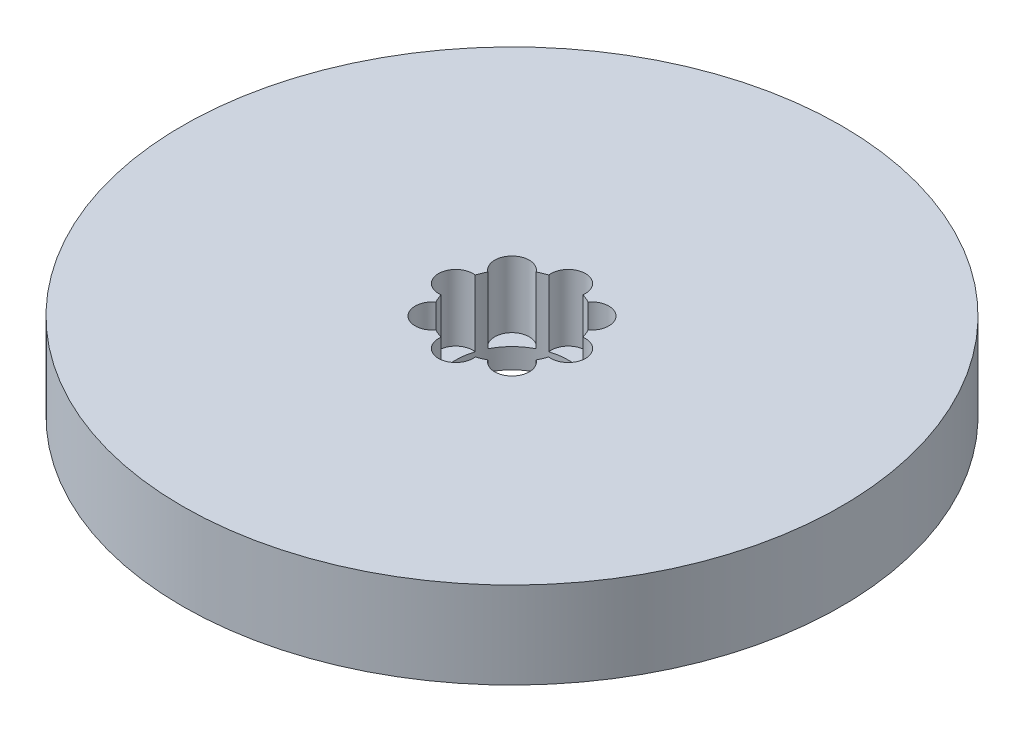
from build123d import *

# Parameters (mm, degrees)
SKETCH1_R           = 87.5
BOSS_EXTRUDE1_DEPTH = 23
SKETCH2_R           = 15
CUT_EXTRUDE1_DEPTH  = 126.863020781
SKETCH3_R           = 4.582702808
CUT_EXTRUDE2_DEPTH  = 17.636179608
CIRPATTERN1_COUNT   = 8


with BuildPart() as part:
    # Sketch1 → Boss-Extrude1 (new body)
    with BuildSketch(Plane(origin=(0, 0, 0), x_dir=(1, 0, 0), z_dir=(0, 1, 0))):
        Circle(SKETCH1_R)
    extrude(amount=BOSS_EXTRUDE1_DEPTH)

    # Sketch2 → Cut-Extrude1 (cut, through all)
    with BuildSketch(Plane(origin=(0, 0, 0), x_dir=(1, 0, 0), z_dir=(0, 1, 0))):
        Circle(SKETCH2_R)
    extrude(amount=CUT_EXTRUDE1_DEPTH, mode=Mode.SUBTRACT)

    # Sketch3 → Cut-Extrude2 (cut)
    with BuildSketch(Plane(origin=(0, 23, 0), x_dir=(1, 0, 0), z_dir=(0, 1, 0))):
        with Locations((-14.936100105, 0)):
            Circle(SKETCH3_R)
    cut_extrude2 = extrude(amount=-CUT_EXTRUDE2_DEPTH, mode=Mode.SUBTRACT)

    # CirPattern1: Cut-Extrude2 ×8 about axis
    cirpattern1_axis = Axis((0, 0, 0), (0, 1, 0))
    for i in range(1, CIRPATTERN1_COUNT):
        add(cut_extrude2.rotate(cirpattern1_axis, i * 360 / CIRPATTERN1_COUNT), mode=Mode.SUBTRACT)


solid = part.part
